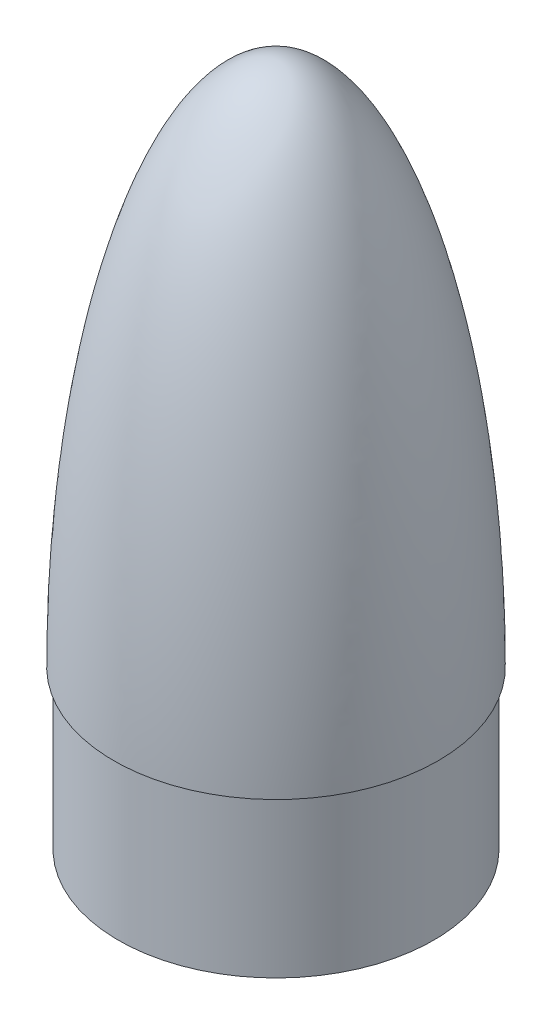
from build123d import *

# Parameters (mm, degrees)
SKETCH2_R           = 76.2
BOSS_EXTRUDE1_DEPTH = 76.2
SKETCH4_R           = 17.78
CUT_EXTRUDE1_DEPTH  = 96.52
CUT_EXTRUDE2_START  = 106.68
SKETCH5_R           = 8.255
CUT_EXTRUDE2_DEPTH  = 119.38
CUT_EXTRUDE3_START  = -25.4
SKETCH19_R          = 15.24
CUT_EXTRUDE3_DEPTH  = 101.6


with BuildPart() as part:
    # Sketch1 → Revolve1 (revolve)
    with BuildSketch(Plane.XY):
        with BuildLine():
            Line((78.359, 0), (0, 0))
            Line((0, 0), (0, 254))
            add(Edge.make_bspline(
                [(78.359, 0), (78.359, 0.547287489), (78.357845602, 1.649563618), (78.352650776, 3.586349875), (78.338796346, 5.988934596), (78.318010672, 8.352211569), (78.29028895, 10.745600888), (78.246958697, 13.731411826), (78.181061307, 17.311703382), (78.08386626, 21.490442467), (77.944822085, 26.264117007), (77.777683186, 31.037557631), (77.58229134, 35.809557456), (77.358460439, 40.580511863), (77.042853487, 46.542286246), (76.679080298, 52.501436144), (76.266448568, 58.457359127), (75.804102806, 64.409607399), (75.404015228, 69.168949637), (74.865626928, 75.114798701), (74.157385744, 82.243973993), (73.238266918, 90.551730955), (72.055740597, 100.030771811), (70.735528943, 109.491671534), (69.270929118, 118.931305028), (67.249996919, 130.699881306), (64.501732948, 144.763840427), (61.308555538, 158.735984092), (57.591049496, 172.577213574), (53.383025938, 186.275905479), (49.238746312, 198.044837449), (44.48323743, 209.587335711), (38.942884235, 220.71924179), (34.256173135, 228.693595393), (29.818710248, 235.095423042), (25.624249732, 240.182852143), (21.978892835, 243.926180276), (18.570150197, 246.859542723), (15.474349081, 249.076247661), (12.563405711, 250.785701438), (9.772327363, 252.083533871), (7.063069709, 253.028642362), (4.275373805, 253.686778481), (2.188006886, 253.939891173), (0.767171586, 253.999916555), (0, 254)],
                knots=[0.083290168, 0.083290168, 0.083290168, 0.083290168, 0.083290168, 0.091119674, 0.09894918, 0.106778686, 0.114608192, 0.122437698, 0.130267203, 0.145926215, 0.161585227, 0.177244239, 0.192903251, 0.208562263, 0.224221275, 0.239880287, 0.27119831, 0.286857322, 0.302516334, 0.318175346, 0.333834359, 0.365152383, 0.396470407, 0.42778843, 0.459106453, 0.490424474, 0.521742495, 0.584378539, 0.647014581, 0.678332609, 0.709650637, 0.772286631, 0.810589211, 0.841907031, 0.872607503, 0.893486158, 0.91262845, 0.928287274, 0.941044948, 0.952387223, 0.962498308, 0.97249612, 0.981348672, 0.989949856, 1, 1, 1, 1, 1], degree=4))
        make_face()
    revolve(axis=Axis((0, 254, 0), (0, -1, 0)))

    # Sketch2 → Boss-Extrude1 (add)
    with BuildSketch(Plane.XZ):
        Circle(SKETCH2_R)
    extrude(amount=BOSS_EXTRUDE1_DEPTH)

    # Sketch4 → Cut-Extrude1 (cut)
    with BuildSketch(Plane(origin=(0, 0, 0), x_dir=(1, 0, 0), z_dir=(0, 1, 0))):
        with Locations((48.26, 0)):
            Circle(SKETCH4_R)
        with Locations((0, -48.26)):
            Circle(SKETCH4_R)
        with Locations((-48.26, 0)):
            Circle(SKETCH4_R)
        with Locations((0, 48.26)):
            Circle(SKETCH4_R)
    extrude(amount=CUT_EXTRUDE1_DEPTH, mode=Mode.SUBTRACT)

    # Sketch5 → Cut-Extrude2 (cut)
    with BuildSketch(Plane(origin=(0, 0, 0), x_dir=(1, 0, 0), z_dir=(0, 1, 0)).offset(CUT_EXTRUDE2_START)):
        with Locations((20.32, 0)):
            Circle(SKETCH5_R)
        with Locations((10.16, -17.597636205)):
            Circle(SKETCH5_R)
        with Locations((-10.16, -17.597636205)):
            Circle(SKETCH5_R)
        with Locations((-20.32, 0)):
            Circle(SKETCH5_R)
        with Locations((-10.16, 17.597636205)):
            Circle(SKETCH5_R)
        with Locations((10.16, 17.597636205)):
            Circle(SKETCH5_R)
    extrude(amount=CUT_EXTRUDE2_DEPTH, mode=Mode.SUBTRACT)

    # Sketch6 → Cut-Revolve2 (revolve, cut)
    with BuildSketch(Plane.XY):
        Polygon((-30.48, 96.52), (-48.26, 117.709378876), (-48.26, 96.52), align=None)
    revolve(axis=Axis((-48.26, 96.52, 0), (0, -1, 0)), mode=Mode.SUBTRACT)

    # Sketch8 → Cut-Revolve4 (revolve, cut)
    with BuildSketch(Plane.XY.offset(48.26)):
        Polygon((0, 96.52), (17.78, 96.52), (0, 117.709378876), align=None)
    revolve(axis=Axis((0, 96.52, 48.26), (0, -1, 0)), mode=Mode.SUBTRACT)

    # Sketch9 → Cut-Revolve5 (revolve, cut)
    with BuildSketch(Plane.XY):
        Polygon((48.26, 96.52), (66.04, 96.52), (48.26, 117.709378876), align=None)
    revolve(axis=Axis((48.26, 96.52, 0), (0, -1, 0)), mode=Mode.SUBTRACT)

    # Sketch11 → Cut-Revolve6 (revolve, cut)
    with BuildSketch(Plane.XY.offset(-48.26)):
        Polygon((0, 96.52), (17.78, 96.52), (0, 117.709378876), align=None)
    revolve(axis=Axis((0, 96.52, -48.26), (0, -1, 0)), mode=Mode.SUBTRACT)

    # Sketch12 → Cut-Revolve7 (revolve, cut)
    with BuildSketch(Plane.XY):
        Polygon((-20.32, 226.06), (-12.065, 226.06), (-20.32, 235.897925907), align=None)
    revolve(axis=Axis((-20.32, 226.06, 0), (0, -1, 0)), mode=Mode.SUBTRACT)

    # Sketch14 → Cut-Revolve8 (revolve, cut)
    with BuildSketch(Plane.XY):
        Polygon((20.32, 226.06), (28.575, 226.06), (20.32, 235.897925907), align=None)
    revolve(axis=Axis((20.32, 235.897925907, 0), (0, -1, 0)), mode=Mode.SUBTRACT)

    # Sketch15 → Cut-Revolve9 (revolve, cut)
    with BuildSketch(Plane.XY.offset(17.597636205)):
        Polygon((-10.16, 226.06), (-1.905, 226.06), (-10.16, 235.897925907), align=None)
    revolve(axis=Axis((-10.16, 226.06, 17.597636205), (0, -1, 0)), mode=Mode.SUBTRACT)

    # Sketch16 → Cut-Revolve10 (revolve, cut)
    with BuildSketch(Plane.XY.offset(17.597636205)):
        Polygon((10.16, 226.06), (18.415, 226.06), (10.16, 235.897925907), align=None)
    revolve(axis=Axis((10.16, 235.897925907, 17.597636205), (0, -1, 0)), mode=Mode.SUBTRACT)

    # Sketch17 → Cut-Revolve11 (revolve, cut)
    with BuildSketch(Plane.XY.offset(-17.597636205)):
        Polygon((10.16, 226.06), (18.415, 226.06), (10.16, 235.897925907), align=None)
    revolve(axis=Axis((10.16, 235.897925907, -17.597636205), (0, -1, 0)), mode=Mode.SUBTRACT)

    # Sketch18 → Cut-Revolve12 (revolve, cut)
    with BuildSketch(Plane.XY.offset(-17.597636205)):
        Polygon((-10.16, 226.06), (-1.905, 226.06), (-10.16, 235.897925907), align=None)
    revolve(axis=Axis((-10.16, 235.897925907, -17.597636205), (0, -1, 0)), mode=Mode.SUBTRACT)

    # Sketch19 → Cut-Extrude3 (cut)
    with BuildSketch(Plane(origin=(0, 0, 0), x_dir=(1, 0, 0), z_dir=(0, 1, 0)).offset(CUT_EXTRUDE3_START)):
        Circle(SKETCH19_R)
    extrude(amount=CUT_EXTRUDE3_DEPTH, mode=Mode.SUBTRACT)

    # Sketch20 → Cut-Revolve13 (revolve, cut)
    with BuildSketch(Plane.XY):
        Polygon((0, 76.2), (15.24, 76.2), (0, 94.362324751), align=None)
    revolve(axis=Axis((0, 270.51, 0), (0, -1, 0)), mode=Mode.SUBTRACT)


solid = part.part
